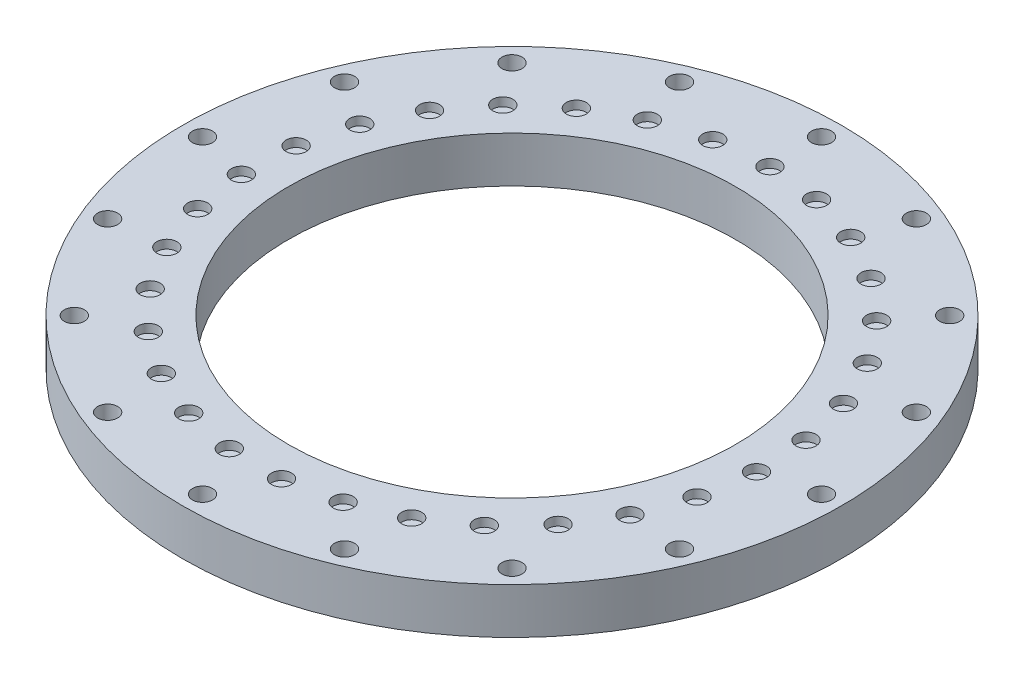
from build123d import *

# Parameters (mm, degrees)
SKETCH1_R           = 57.5
SKETCH1_R_2         = 39
BOSS_EXTRUDE1_DEPTH = 8
SKETCH2_R           = 1.75
CUT_EXTRUDE1_DEPTH  = 17
SKETCH3_R           = 1.75
CUT_EXTRUDE2_DEPTH  = 1.5


with BuildPart() as part:
    # Sketch1 → Boss-Extrude1 (new body)
    with BuildSketch(Plane(origin=(0, 0, 0), x_dir=(1, 0, 0), z_dir=(0, 1, 0))):
        Circle(SKETCH1_R)
        Circle(SKETCH1_R_2, mode=Mode.SUBTRACT)
    extrude(amount=BOSS_EXTRUDE1_DEPTH)

    # Sketch2 → Cut-Extrude1 (cut)
    with BuildSketch(Plane(origin=(0, 8, 0), x_dir=(1, 0, 0), z_dir=(0, 1, 0))):
        with Locations((0, 54)):
            Circle(SKETCH2_R)
        with Locations((20.664905348, 49.889494756)):
            Circle(SKETCH2_R)
        with Locations((38.183766184, 38.183766184)):
            Circle(SKETCH2_R)
        with Locations((49.889494756, 20.664905348)):
            Circle(SKETCH2_R)
        with Locations((54, 0)):
            Circle(SKETCH2_R)
        with Locations((49.889494756, -20.664905348)):
            Circle(SKETCH2_R)
        with Locations((38.183766184, -38.183766184)):
            Circle(SKETCH2_R)
        with Locations((20.664905348, -49.889494756)):
            Circle(SKETCH2_R)
        with Locations((0, -54)):
            Circle(SKETCH2_R)
        with Locations((-20.664905348, -49.889494756)):
            Circle(SKETCH2_R)
        with Locations((-38.183766184, -38.183766184)):
            Circle(SKETCH2_R)
        with Locations((-49.889494756, -20.664905348)):
            Circle(SKETCH2_R)
        with Locations((-54, 0)):
            Circle(SKETCH2_R)
        with Locations((-49.889494756, 20.664905348)):
            Circle(SKETCH2_R)
        with Locations((-38.183766184, 38.183766184)):
            Circle(SKETCH2_R)
        with Locations((-20.664905348, 49.889494756)):
            Circle(SKETCH2_R)
    extrude(amount=-CUT_EXTRUDE1_DEPTH, mode=Mode.SUBTRACT)

    # Sketch3 → Cut-Extrude2 (cut)
    with BuildSketch(Plane(origin=(0, 8, 0), x_dir=(1, 0, 0), z_dir=(0, 1, 0))):
        with Locations((0, 45)):
            Circle(SKETCH3_R)
        with Locations((9.058433404, 44.078847356)):
            Circle(SKETCH3_R)
        with Locations((17.74601348, 41.353101523)):
            Circle(SKETCH3_R)
        with Locations((25.707069679, 36.934354854)):
            Circle(SKETCH3_R)
        with Locations((32.615675425, 31.003511358)):
            Circle(SKETCH3_R)
        with Locations((38.188991587, 23.803380465)):
            Circle(SKETCH3_R)
        with Locations((42.198845947, 15.628736378)):
            Circle(SKETCH3_R)
        with Locations((44.481074595, 6.814249988)):
            Circle(SKETCH3_R)
        with Locations((44.942242823, -2.279212598)):
            Circle(SKETCH3_R)
        with Locations((43.563470349, -11.279363952)):
            Circle(SKETCH3_R)
        with Locations((40.401204281, -19.81773682)):
            Circle(SKETCH3_R)
        with Locations((35.584908162, -27.544769215)):
            Circle(SKETCH3_R)
        with Locations((29.311761723, -34.144115521)):
            Circle(SKETCH3_R)
        with Locations((21.838588314, -39.345597727)):
            Circle(SKETCH3_R)
        with Locations((13.471340534, -42.936266538)):
            Circle(SKETCH3_R)
        with Locations((4.552574489, -44.769119553)):
            Circle(SKETCH3_R)
        with Locations((-4.552574489, -44.769119553)):
            Circle(SKETCH3_R)
        with Locations((-13.471340534, -42.936266538)):
            Circle(SKETCH3_R)
        with Locations((-21.838588314, -39.345597727)):
            Circle(SKETCH3_R)
        with Locations((-29.311761722, -34.144115521)):
            Circle(SKETCH3_R)
        with Locations((-35.584908162, -27.544769215)):
            Circle(SKETCH3_R)
        with Locations((-40.401204281, -19.81773682)):
            Circle(SKETCH3_R)
        with Locations((-43.563470349, -11.279363952)):
            Circle(SKETCH3_R)
        with Locations((-44.942242823, -2.279212598)):
            Circle(SKETCH3_R)
        with Locations((-44.481074595, 6.814249988)):
            Circle(SKETCH3_R)
        with Locations((-42.198845947, 15.628736378)):
            Circle(SKETCH3_R)
        with Locations((-38.188991587, 23.803380465)):
            Circle(SKETCH3_R)
        with Locations((-32.615675425, 31.003511358)):
            Circle(SKETCH3_R)
        with Locations((-25.707069679, 36.934354854)):
            Circle(SKETCH3_R)
        with Locations((-17.74601348, 41.353101523)):
            Circle(SKETCH3_R)
        with Locations((-9.058433404, 44.078847356)):
            Circle(SKETCH3_R)
    extrude(amount=-CUT_EXTRUDE2_DEPTH, mode=Mode.SUBTRACT)


solid = part.part
